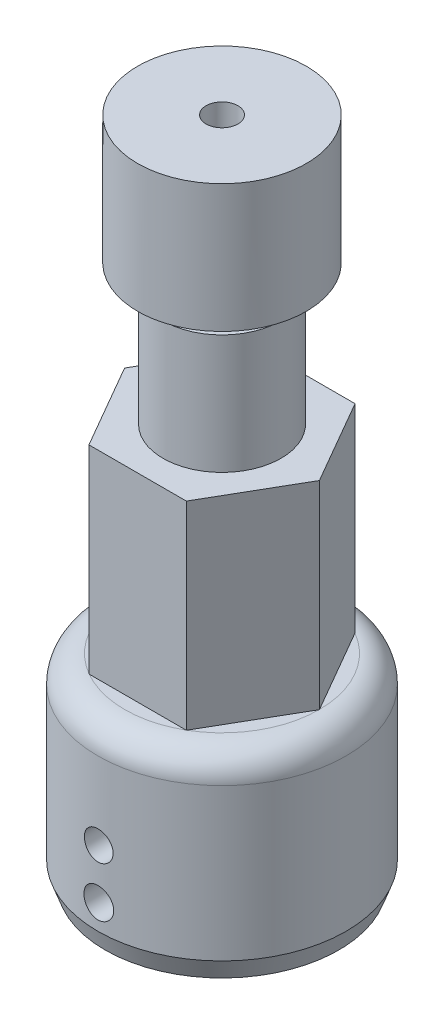
from build123d import *

# Parameters (mm, degrees)
SKETCH1_R               = 5.95
BOSS_EXTRUDE1_DEPTH     = 40
SKETCH1_2_R             = 5.95
BOSS_EXTRUDE2_DEPTH     = 52
SKETCH2_R               = 12.5
BOSS_EXTRUDE3_DEPTH     = 15
CUT_EXTRUDE1_DEPTH      = 55.922672914
CUT_EXTRUDE1_DEPTH_BACK = 55.922672914
SKETCH3_R               = 1.45
SKETCH3_R_2             = 1.5
SKETCH5_R               = 12.5
BOSS_EXTRUDE4_DEPTH     = 5
SKETCH7_R               = 8.5
SKETCH7_R_2             = 6
BOSS_EXTRUDE5_DEPTH     = 15
SKETCH8_R               = 6
SKETCH8_R_2             = 1.6
BOSS_EXTRUDE6_DEPTH     = 3
SKETCH9_R               = 8.5
CUT_EXTRUDE4_DEPTH      = 2.1
BOSS_EXTRUDE7_START     = -20
SKETCH6_R               = 1.85
SKETCH6_R_2             = 1.5
BOSS_EXTRUDE7_DEPTH     = 20
CUT_EXTRUDE5_START      = -20
CUT_EXTRUDE5_DEPTH      = 20
CHAMFER1_SIZE           = 1
CHAMFER1_SIZE_2         = 0.363970234
FILLET1_R               = 2.7
CHAMFER2_SIZE           = 2
CHAMFER2_SIZE2          = 0.727940469


with BuildPart() as part:
    # Sketch1 → Boss-Extrude1 (new body)
    with BuildSketch(Plane(origin=(0, 0, 0), x_dir=(1, 0, 0), z_dir=(0, 1, 0))):
        Polygon((-4.907477288, -8.5), (4.907477288, -8.5), (9.814954576, 0), (4.907477288, 8.5), (-4.907477288, 8.5), (-9.814954576, 0), align=None)
        with Locations(Location((0, 0, 0), (0, 0, 270))):
            Circle(SKETCH1_R, mode=Mode.SUBTRACT)
    extrude(amount=BOSS_EXTRUDE1_DEPTH)

    # Sketch1<2> → Boss-Extrude2 (add)
    with BuildSketch(Plane(origin=(0, 0, 0), x_dir=(1, 0, 0), z_dir=(0, 1, 0))):
        with Locations(Location((0, 0, 0), (0, 0, 90))):
            Circle(SKETCH1_2_R)
        with BuildLine():
            Line((-1.2, 1.408012784), (1.2, 1.408012784))
            ThreePointArc((1.2, 1.408012784), (0, -1.85), (-1.2, 1.408012784))
        make_face(mode=Mode.SUBTRACT)
    extrude(amount=BOSS_EXTRUDE2_DEPTH)

    # Sketch2 → Boss-Extrude3 (add)
    with BuildSketch(Plane.XZ):
        with Locations(Location((0, 0, 0), (0, 0, 270))):
            Circle(SKETCH2_R)
        Polygon((4.907477288, 8.5), (-4.907477288, 8.5), (-9.814954576, 0), (-4.907477288, -8.5), (4.907477288, -8.5), (9.814954576, 0), align=None, mode=Mode.SUBTRACT)
    extrude(amount=-BOSS_EXTRUDE3_DEPTH)

    # Sketch3 → Cut-Extrude1 (cut, two sides: drawn at the far end of the back side and taken through both)
    with BuildSketch(Plane.XY.offset(-CUT_EXTRUDE1_DEPTH_BACK)):
        with Locations((0, 9.5)):
            Circle(SKETCH3_R)
        with Locations((0, 4.5)):
            Circle(SKETCH3_R_2)
    extrude(amount=CUT_EXTRUDE1_DEPTH + CUT_EXTRUDE1_DEPTH_BACK, mode=Mode.SUBTRACT)

    # Sketch5 → Boss-Extrude4 (add)
    with BuildSketch(Plane(origin=(0, 15, 0), x_dir=(1, 0, 0), z_dir=(0, 1, 0))):
        with Locations(Location((0, 0, 0), (0, 0, 90))):
            Circle(SKETCH5_R)
        Polygon((9.814954576, 0), (4.907477288, -8.5), (-4.907477288, -8.5), (-9.814954576, 0), (-4.907477288, 8.5), (4.907477288, 8.5), align=None, mode=Mode.SUBTRACT)
    extrude(amount=BOSS_EXTRUDE4_DEPTH)

    # Sketch6 → Boss-Extrude7 (add)
    with BuildSketch(Plane(origin=(0, 52, 0), x_dir=(1, 0, 0), z_dir=(0, 1, 0)).offset(BOSS_EXTRUDE7_START)):
        Circle(SKETCH6_R)
        Circle(SKETCH6_R_2, mode=Mode.SUBTRACT)
    extrude(amount=BOSS_EXTRUDE7_DEPTH)

    # Sketch6<2> → Cut-Extrude5 (cut)
    with BuildSketch(Plane(origin=(0, 52, 0), x_dir=(1, 0, 0), z_dir=(0, 1, 0)).offset(CUT_EXTRUDE5_START)):
        with BuildLine():
            Line((-0.517204022, 1.408012784), (0.517204022, 1.408012784))
            ThreePointArc((0.517204022, 1.408012784), (0, 1.5), (-0.517204022, 1.408012784))
        make_face()
        with BuildLine():
            ThreePointArc((1.5, 0), (1.230001226, 0.858543525), (0.517204022, 1.408012784))
            Line((0.517204022, 1.408012784), (-0.517204022, 1.408012784))
            ThreePointArc((-0.517204022, 1.408012784), (-0.858543525, -1.230001226), (1.5, 0))
        make_face()
    extrude(amount=CUT_EXTRUDE5_DEPTH, mode=Mode.SUBTRACT)

    # Chamfer1
    # the kernel refuses this chamfer: 1, 0.363970234 mm, written as the material it takes off along each edge
    with BuildSketch(Plane(origin=(0, 32, 0), x_dir=(0.9823803136047933, 0, -0.1868928020062522), z_dir=(0.1868928020062522, 0, 0.9823803136047933))) as chamfer1_piece_1_section:
        Polygon((1.5, CHAMFER1_SIZE), (1.5 + CHAMFER1_SIZE_2, 0), (1.5, 0), align=None)
    chamfer1_piece_1 = revolve(axis=Axis((0, 32, 0), (0, 1, 0)), revolution_arc=349.228493073, mode=Mode.PRIVATE)
    chamfer1_piece_1 = chamfer1_piece_1 & Plane(origin=(0, 32.340011658, 0), x_dir=(0.6486486486486487, 0, -0.7610879913691202), z_dir=(0, -1, 0)) * Cylinder(1.85, 8, mode=Mode.PRIVATE)
    chamfer1_piece_1 = split(chamfer1_piece_1, bisect_by=Plane(origin=(1.266565325, 32.340011658, -1.408012784), z_dir=(0, 0, 1)), keep=Keep.TOP, mode=Mode.PRIVATE)
    add(chamfer1_piece_1, mode=Mode.SUBTRACT)
    with BuildSketch(Plane(origin=(0, 32, 0), x_dir=(1, 0, 0), z_dir=(0, 0, 1))) as chamfer1_piece_2_section:
        Polygon((1.5, CHAMFER1_SIZE), (1.5 + CHAMFER1_SIZE_2, 0), (1.5, 0), align=None)
    chamfer1_piece_2 = revolve(axis=Axis((0, 32, 0), (0, 1, 0)), revolution_arc=168.945149076, mode=Mode.PRIVATE)
    chamfer1_piece_2 = chamfer1_piece_2 & Plane(origin=(0, 32.337814983, 0), x_dir=(0.6486486486486487, 0, -0.7610879913691202), z_dir=(0, -1, 0)) * Cylinder(1.85, 8, mode=Mode.PRIVATE)
    chamfer1_piece_2 = split(chamfer1_piece_2, bisect_by=Plane(origin=(1.32853584, 32.337814983, -1.408012784), z_dir=(0, 0, 1)), keep=Keep.TOP, mode=Mode.PRIVATE)
    add(chamfer1_piece_2, mode=Mode.SUBTRACT)

    # Fillet1
    # the kernel refuses this fillet: 2.7 mm, written as the material it takes off along each edge
    with BuildSketch(Plane(origin=(0, 20, 0), x_dir=(0, 0, -1), z_dir=(1, 0, 0))) as fillet1_piece_1_section:
        with BuildLine():
            CenterArc((12.5 - FILLET1_R, -FILLET1_R), FILLET1_R, 0, 90)
            Line((12.5, -FILLET1_R), (12.5, 0))
            Line((12.5, 0), (12.5 - FILLET1_R, 0))
        make_face()
    fillet1_piece_1 = revolve(axis=Axis((0, 20, 0), (0, 1, 0)), mode=Mode.PRIVATE)
    fillet1_piece_1 = split(fillet1_piece_1, bisect_by=Plane(origin=(1.041e-06, 19.432642302, -8.5), z_dir=(0, 0, -1)), keep=Keep.TOP, mode=Mode.PRIVATE)
    add(fillet1_piece_1, mode=Mode.SUBTRACT)
    with BuildSketch(Plane(origin=(0, 20, 0), x_dir=(0, 0, -1), z_dir=(1, 0, 0))) as fillet1_piece_2_section:
        with BuildLine():
            CenterArc((12.5 - FILLET1_R, -FILLET1_R), FILLET1_R, 0, 90)
            Line((12.5, -FILLET1_R), (12.5, 0))
            Line((12.5, 0), (12.5 - FILLET1_R, 0))
        make_face()
    fillet1_piece_2 = revolve(axis=Axis((0, 20, 0), (0, 1, 0)), mode=Mode.PRIVATE)
    fillet1_piece_2 = split(fillet1_piece_2, bisect_by=Plane(origin=(-7.361214724, 19.432641737, -4.250002093), z_dir=(-0.8660254037844416, 0, -0.49999999999999484)), keep=Keep.TOP, mode=Mode.PRIVATE)
    add(fillet1_piece_2, mode=Mode.SUBTRACT)
    with BuildSketch(Plane(origin=(0, 20, 0), x_dir=(0, 0, -1), z_dir=(1, 0, 0))) as fillet1_piece_3_section:
        with BuildLine():
            CenterArc((12.5 - FILLET1_R, -FILLET1_R), FILLET1_R, 0, 90)
            Line((12.5, -FILLET1_R), (12.5, 0))
            Line((12.5, 0), (12.5 - FILLET1_R, 0))
        make_face()
    fillet1_piece_3 = revolve(axis=Axis((0, 20, 0), (0, 1, 0)), mode=Mode.PRIVATE)
    fillet1_piece_3 = split(fillet1_piece_3, bisect_by=Plane(origin=(7.361217141, 19.432641737, -4.249997907), z_dir=(0.8660254037844382, 0, -0.5000000000000011)), keep=Keep.TOP, mode=Mode.PRIVATE)
    add(fillet1_piece_3, mode=Mode.SUBTRACT)
    with BuildSketch(Plane(origin=(0, 20, 0), x_dir=(0, 0, -1), z_dir=(1, 0, 0))) as fillet1_piece_4_section:
        with BuildLine():
            CenterArc((12.5 - FILLET1_R, -FILLET1_R), FILLET1_R, 0, 90)
            Line((12.5, -FILLET1_R), (12.5, 0))
            Line((12.5, 0), (12.5 - FILLET1_R, 0))
        make_face()
    fillet1_piece_4 = revolve(axis=Axis((0, 20, 0), (0, 1, 0)), mode=Mode.PRIVATE)
    fillet1_piece_4 = split(fillet1_piece_4, bisect_by=Plane(origin=(-7.361217141, 19.432641737, 4.249997907), z_dir=(-0.8660254037844347, 0, 0.500000000000007)), keep=Keep.TOP, mode=Mode.PRIVATE)
    add(fillet1_piece_4, mode=Mode.SUBTRACT)
    with BuildSketch(Plane(origin=(0, 20, 0), x_dir=(0, 0, -1), z_dir=(1, 0, 0))) as fillet1_piece_5_section:
        with BuildLine():
            CenterArc((12.5 - FILLET1_R, -FILLET1_R), FILLET1_R, 0, 90)
            Line((12.5, -FILLET1_R), (12.5, 0))
            Line((12.5, 0), (12.5 - FILLET1_R, 0))
        make_face()
    fillet1_piece_5 = revolve(axis=Axis((0, 20, 0), (0, 1, 0)), mode=Mode.PRIVATE)
    fillet1_piece_5 = split(fillet1_piece_5, bisect_by=Plane(origin=(7.361214724, 19.432641737, 4.250002093), z_dir=(0.8660254037844416, 0, 0.49999999999999495)), keep=Keep.TOP, mode=Mode.PRIVATE)
    add(fillet1_piece_5, mode=Mode.SUBTRACT)
    with BuildSketch(Plane(origin=(0, 20, 0), x_dir=(0, 0, -1), z_dir=(1, 0, 0))) as fillet1_piece_6_section:
        with BuildLine():
            CenterArc((12.5 - FILLET1_R, -FILLET1_R), FILLET1_R, 0, 90)
            Line((12.5, -FILLET1_R), (12.5, 0))
            Line((12.5, 0), (12.5 - FILLET1_R, 0))
        make_face()
    fillet1_piece_6 = revolve(axis=Axis((0, 20, 0), (0, 1, 0)), mode=Mode.PRIVATE)
    fillet1_piece_6 = split(fillet1_piece_6, bisect_by=Plane(origin=(-2.417e-06, 19.432641737, 8.5), z_dir=(0, 0, 1)), keep=Keep.TOP, mode=Mode.PRIVATE)
    add(fillet1_piece_6, mode=Mode.SUBTRACT)

    # Chamfer2
    chamfer2_edges = [part.edges().sort_by_distance(p)[0] for p in [
        (0, 0, 12.5),
    ]]
    chamfer2_side = [part.faces().sort_by_distance(p)[0] for p in [
        (0, 7.5, 12.5),
    ]]
    chamfer(chamfer2_edges, length=CHAMFER2_SIZE, length2=CHAMFER2_SIZE2, reference=chamfer2_side[0])


with BuildPart() as body_2:
    # Sketch7 → Boss-Extrude5 (new body)
    with BuildSketch(Plane(origin=(0, 52, 0), x_dir=(1, 0, 0), z_dir=(0, 1, 0))):
        with Locations(Location((0, 0, 0), (0, 0, 270))):
            Circle(SKETCH7_R)
        with Locations(Location((0, 0, 0), (0, 0, 270))):
            Circle(SKETCH7_R_2, mode=Mode.SUBTRACT)
    extrude(amount=BOSS_EXTRUDE5_DEPTH)

    # Sketch8 → Boss-Extrude6 (add)
    with BuildSketch(Plane(origin=(0, 67, 0), x_dir=(1, 0, 0), z_dir=(0, 1, 0))):
        with Locations(Location((0, 0, 0), (0, 0, 270))):
            Circle(SKETCH8_R)
        with Locations(Location((0, 0, 0), (0, 0, 270))):
            Circle(SKETCH8_R_2, mode=Mode.SUBTRACT)
    extrude(amount=-BOSS_EXTRUDE6_DEPTH)

    # Sketch9 → Cut-Extrude4 (cut)
    with BuildSketch(Plane.XZ.offset(-52)):
        with Locations(Location((0, 0, 0), (0, 0, 270))):
            Circle(SKETCH9_R)
    extrude(amount=-CUT_EXTRUDE4_DEPTH, mode=Mode.SUBTRACT)


solid = Compound([part.part, body_2.part])
